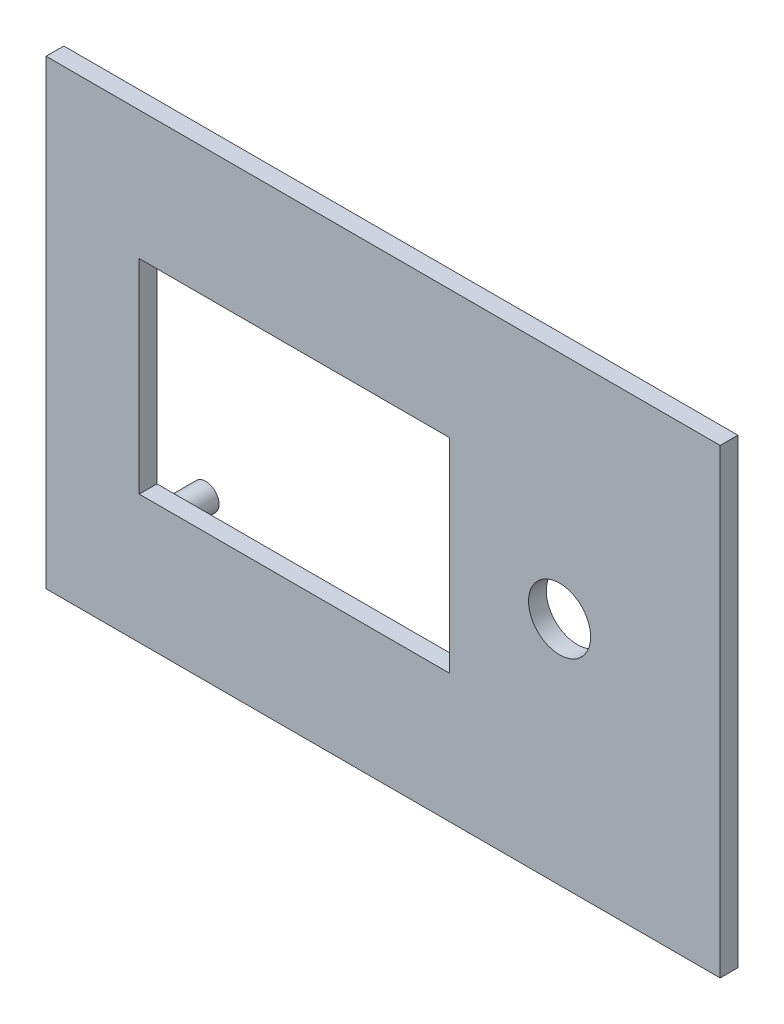
from build123d import *

# Parameters (mm, degrees)
SKIZZE10_W                      = 76
SKIZZE10_H                      = 52
AUFSATZ_LINEAR_AUSTRAGEN8_DEPTH = 2
SKIZZE11_W                      = 35
SKIZZE11_H                      = 23
SCHNITT_LINEAR_AUSTRAGEN3_DEPTH = 2
SKIZZE13_R                      = 3.5
SCHNITT_LINEAR_AUSTRAGEN4_DEPTH = 2
SKIZZE14_R                      = 1.5
AUFSATZ_LINEAR_AUSTRAGEN9_DEPTH = 4


with BuildPart() as part:
    # Skizze10 → Aufsatz-Linear austragen8 (new body)
    with BuildSketch(Plane.XY):
        with Locations((-18.490421456, -28.402298851)):
            Rectangle(SKIZZE10_W, SKIZZE10_H)
    extrude(amount=AUFSATZ_LINEAR_AUSTRAGEN8_DEPTH)

    # Skizze11 → Schnitt-Linear austragen3 (cut)
    with BuildSketch(Plane.XY.offset(2)):
        with Locations((-28.486972684, -28.402298851)):
            Rectangle(SKIZZE11_W, SKIZZE11_H)
    extrude(amount=-SCHNITT_LINEAR_AUSTRAGEN3_DEPTH, mode=Mode.SUBTRACT)

    # Skizze13 → Schnitt-Linear austragen4 (cut)
    with BuildSketch(Plane.XY.offset(2)):
        with Locations((1.402178344, -28.402298851)):
            Circle(SKIZZE13_R)
    extrude(amount=-SCHNITT_LINEAR_AUSTRAGEN4_DEPTH, mode=Mode.SUBTRACT)

    # Skizze14 → Aufsatz-Linear austragen9 (add)
    with BuildSketch(Plane(origin=(0, 0, 0), x_dir=(-1, 0, 0), z_dir=(0, 0, -1))):
        with Locations((44.486972684, -14.402298851)):
            Circle(SKIZZE14_R)
        with Locations((44.486972684, -42.402298851)):
            Circle(SKIZZE14_R)
        with Locations((12.486972684, -14.402298851)):
            Circle(SKIZZE14_R)
        with Locations((12.486972684, -42.402298851)):
            Circle(SKIZZE14_R)
    extrude(amount=AUFSATZ_LINEAR_AUSTRAGEN9_DEPTH)


solid = part.part
